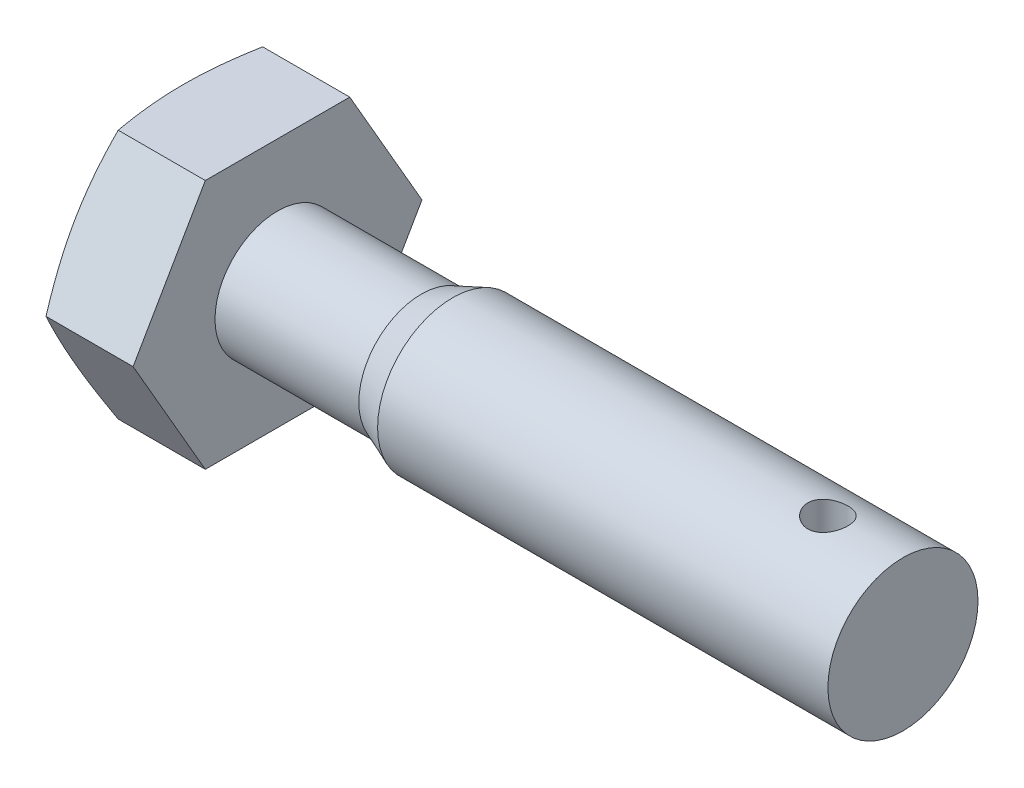
from build123d import *

# Parameters (mm, degrees)
BASEHEAD_DEPTH     = 4
SKETCH2_R          = 3
BASEBODY_DEPTH     = 25
SKETCH4_R          = 3.4
CUT_EXTRUDE1_DEPTH = 0.8
HOLE_DEPTH         = 30.988886831
HOLE_DEPTH_BACK    = 30.988886831
SKETCH6_R          = 0.8


with BuildPart() as part:
    # Sketch1 → BaseHead (new body)
    with BuildSketch(Plane(origin=(0, 0, 0), x_dir=(0, 0, -1), z_dir=(1, 0, 0))):
        Polygon((2.886751346, -5), (5.773502692, 0), (2.886751346, 5), (-2.886751346, 5), (-5.773502692, 0), (-2.886751346, -5), align=None)
    extrude(amount=BASEHEAD_DEPTH)

    # Sketch2 → BaseBody (add)
    with BuildSketch(Plane(origin=(4, 0, 0), x_dir=(0, 0, -1), z_dir=(1, 0, 0))):
        Circle(SKETCH2_R)
    extrude(amount=BASEBODY_DEPTH)

    # Sketch3 → HeadChamfer (revolve, cut)
    with BuildSketch(Plane(origin=(3.161211974, 0, 2.612290718), x_dir=(0, 0, -1), z_dir=(0, 1, 0))):
        Polygon((8.38579341, 3.161211974), (8.38579341, 2.643099366), (6.962290718, 3.161211974), align=None)
    revolve(axis=Axis((1.089857486, 0, 0), (1, 0, 0)), mode=Mode.SUBTRACT)

    # Sketch4 → Cut-Extrude1 (cut)
    with BuildSketch(Plane(origin=(0, 0, 0), x_dir=(0, 0, -1), z_dir=(1, 0, 0))):
        Circle(SKETCH4_R)
    extrude(amount=CUT_EXTRUDE1_DEPTH, mode=Mode.SUBTRACT)

    # Sketch5 → Cut-Revolve1 (revolve, cut)
    with BuildSketch(Plane(origin=(-2.92963122, 0, 7.92963122), x_dir=(0, 0, -1), z_dir=(0, 1, 0))):
        Polygon((10.92963122, -13.92963122), (10.42963122, -12.67963122), (10.42963122, -6.92963122), (12.92963122, -6.92963122), (12.92963122, -13.92963122), align=None)
    revolve(axis=Axis((0, 0, 0), (1, 0, 0)), mode=Mode.SUBTRACT)

    # Sketch6 → Hole (cut, two sides: drawn at the far end of the back side and taken through both)
    with BuildSketch(Plane(origin=(0, 0, 0), x_dir=(1, 0, 0), z_dir=(0, 1, 0)).offset(-HOLE_DEPTH_BACK)):
        with Locations((26, 0)):
            Circle(SKETCH6_R)
    extrude(amount=HOLE_DEPTH + HOLE_DEPTH_BACK, mode=Mode.SUBTRACT)


solid = part.part
